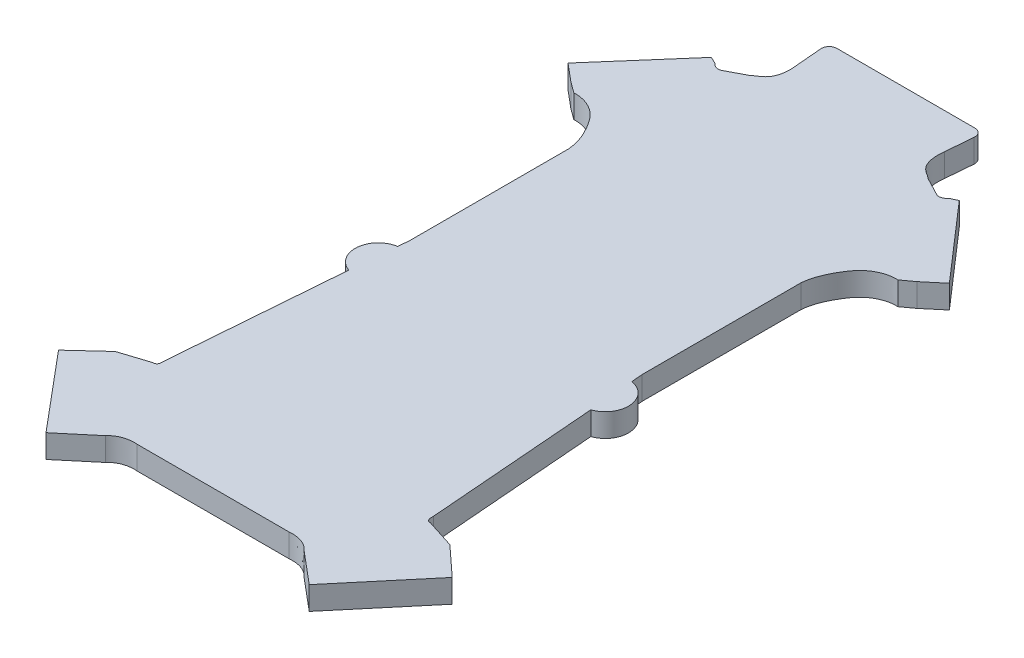
from build123d import *

# Parameters (mm, degrees)
SKETCH1_W               = 200
SKETCH1_H               = 200
BOSS_EXTRUDE1_DEPTH     = 6
CUT_EXTRUDE2_DEPTH      = 283.906344927
CUT_EXTRUDE2_DEPTH_BACK = 283.906344927
SKETCH2_W               = 200
SKETCH2_H               = 200


with BuildPart() as part:
    # Sketch1 → Boss-Extrude1 (new body)
    with BuildSketch(Plane(origin=(0, 0, 0), x_dir=(1, 0, 0), z_dir=(0, 1, 0))):
        with Locations((100, 100)):
            Rectangle(SKETCH1_W, SKETCH1_H)
    extrude(amount=BOSS_EXTRUDE1_DEPTH)

    # Sketch2 → Cut-Extrude2 (cut, two sides: drawn at the far end of the back side and taken through both)
    with BuildSketch(Plane.XZ.offset(-CUT_EXTRUDE2_DEPTH_BACK)):
        with Locations((100, -100)):
            Rectangle(SKETCH2_W, SKETCH2_H)
        with BuildLine():
            Line((142.470263104, -38.474324409), (138.980590781, -82.567766807))
            ThreePointArc((138.980590781, -82.567766807), (143.011978906, -88.766433857), (137.965449307, -94.170885949))
            Line((137.965449307, -94.170885949), (137.713922077, -97.045855348))
            Line((137.713922077, -97.045855348), (137.713922077, -138.1223021))
            add(Edge.make_bspline(
                [(137.713922077, -138.1223021), (137.910971425, -140.698667647), (139.507724307, -144.457777555), (142.489740529, -148.872812205), (145.949969804, -150.949581761), (148.343945052, -151.37521624), (149.581724405, -151.314063329)],
                knots=[0, 0, 0, 0, 0.390118095, 0.632217619, 0.808161049, 1, 1, 1, 1], degree=3))
            Line((149.581724405, -151.314063329), (152.427141441, -153.392859596))
            Line((152.427141441, -153.392859596), (156.986289709, -157.218439282))
            Line((156.986289709, -157.218439282), (139.760542288, -176.994089226))
            Line((139.760542288, -176.994089226), (137.872319022, -176.131374478))
            ThreePointArc((137.872319022, -176.131374478), (136.91527504, -175.381606613), (135.700846436, -175.324613604))
            Line((135.700846436, -175.324613604), (130.853598478, -177.858137977))
            add(Edge.make_bspline(
                [(130.853598478, -177.858137977), (130.075801009, -178.546449028), (126.916805909, -179.962928834), (126.6337231, -184.070400606), (126.927026035, -186.070348944)],
                knots=[0, 0, 0, 0, 0.321172205, 1, 1, 1, 1], degree=3))
            Line((126.927026035, -186.070348944), (127.521236933, -193.074432072))
            ThreePointArc((127.521236933, -193.074432072), (127.001171398, -194.596619487), (125.528395762, -195.243500167))
            Line((125.528395762, -195.243500167), (89.899448462, -195.243500167))
            ThreePointArc((89.899448462, -195.243500167), (88.426672826, -194.596619487), (87.906607291, -193.074432072))
            Line((87.906607291, -193.074432072), (88.500818189, -186.070348944))
            add(Edge.make_bspline(
                [(84.574245746, -177.858137977), (85.352043215, -178.546449028), (88.511038315, -179.962928834), (88.794121124, -184.070400606), (88.500818189, -186.070348944)],
                knots=[0, 0, 0, 0, 0.321172205, 1, 1, 1, 1], degree=3))
            Line((84.574245746, -177.858137977), (79.726997788, -175.324613604))
            ThreePointArc((79.726997788, -175.324613604), (78.512569184, -175.381606613), (77.555525202, -176.131374478))
            Line((77.555525202, -176.131374478), (75.667301936, -176.994089226))
            Line((75.667301936, -176.994089226), (58.441554515, -157.218439282))
            Line((58.441554515, -157.218439282), (63.000702783, -153.392859596))
            Line((63.000702783, -153.392859596), (65.846119819, -151.314063329))
            add(Edge.make_bspline(
                [(77.713922147, -138.1223021), (77.516872799, -140.698667647), (75.920119917, -144.457777555), (72.938103695, -148.872812205), (69.47787442, -150.949581761), (67.083899172, -151.37521624), (65.846119819, -151.314063329)],
                knots=[0, 0, 0, 0, 0.390118095, 0.632217619, 0.808161049, 1, 1, 1, 1], degree=3))
            Line((77.713922147, -138.1223021), (77.713922147, -97.045855348))
            Line((77.713922147, -97.045855348), (77.462394917, -94.170885949))
            ThreePointArc((77.462394917, -94.170885949), (72.415865318, -88.766433857), (76.447253443, -82.567766807))
            Line((76.447253443, -82.567766807), (72.95758112, -38.474324409))
            add(Edge.make_bspline(
                [(71.87426297, -36.548342356), (73.029938343, -36.460716162), (72.980934293, -37.754807476), (72.95758112, -38.474324409)],
                knots=[0, 0, 0, 0, 1, 1, 1, 1], degree=3))
            Line((71.87426297, -36.548342356), (64.478115645, -34.172936949))
            Line((64.478115645, -34.172936949), (56.844705506, -27.15016108))
            Line((56.844705506, -27.15016108), (73.702448882, -7.059884849))
            Line((73.702448882, -7.059884849), (82.071867264, -14.082660727))
            add(Edge.make_bspline(
                [(82.071867264, -14.082660727), (83.531498014, -15.797125091), (85.909052414, -16.455495939), (88.081926144, -16.243500168)],
                knots=[0, 0, 0, 0, 1, 1, 1, 1], degree=3))
            Line((88.081926144, -16.243500168), (127.34591808, -16.243500168))
            add(Edge.make_bspline(
                [(133.35597696, -14.082660727), (131.89634621, -15.797125091), (129.51879181, -16.455495939), (127.34591808, -16.243500168)],
                knots=[0, 0, 0, 0, 1, 1, 1, 1], degree=3))
            Line((133.35597696, -14.082660727), (141.725395342, -7.059884849))
            Line((141.725395342, -7.059884849), (158.583138718, -27.15016108))
            Line((158.583138718, -27.15016108), (150.949728579, -34.172936949))
            Line((150.949728579, -34.172936949), (143.553581254, -36.548342356))
            add(Edge.make_bspline(
                [(143.553581254, -36.548342356), (142.397905881, -36.460716162), (142.446909931, -37.754807476), (142.470263104, -38.474324409)],
                knots=[0, 0, 0, 0, 1, 1, 1, 1], degree=3))
        make_face(mode=Mode.SUBTRACT)
    extrude(amount=CUT_EXTRUDE2_DEPTH + CUT_EXTRUDE2_DEPTH_BACK, mode=Mode.SUBTRACT)


solid = part.part
